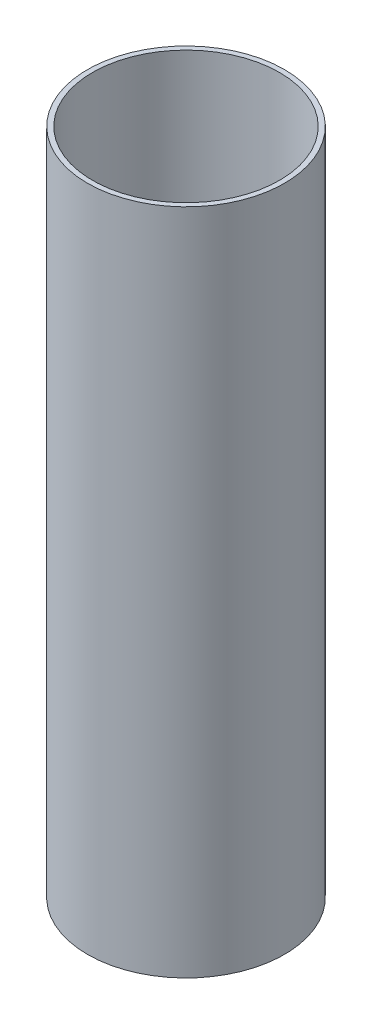
from build123d import *

# Parameters (mm, degrees)
SKETCH1_R           = 93.6625
SKETCH1_R_2         = 88.9
BOSS_EXTRUDE1_DEPTH = 317.5


with BuildPart() as part:
    # Sketch1 → Boss-Extrude1 (new, symmetric)
    with BuildSketch(Plane(origin=(0, 0, 0), x_dir=(1, 0, 0), z_dir=(0, 1, 0))):
        Circle(SKETCH1_R)
        Circle(SKETCH1_R_2, mode=Mode.SUBTRACT)
    extrude(amount=BOSS_EXTRUDE1_DEPTH, both=True)


solid = part.part
